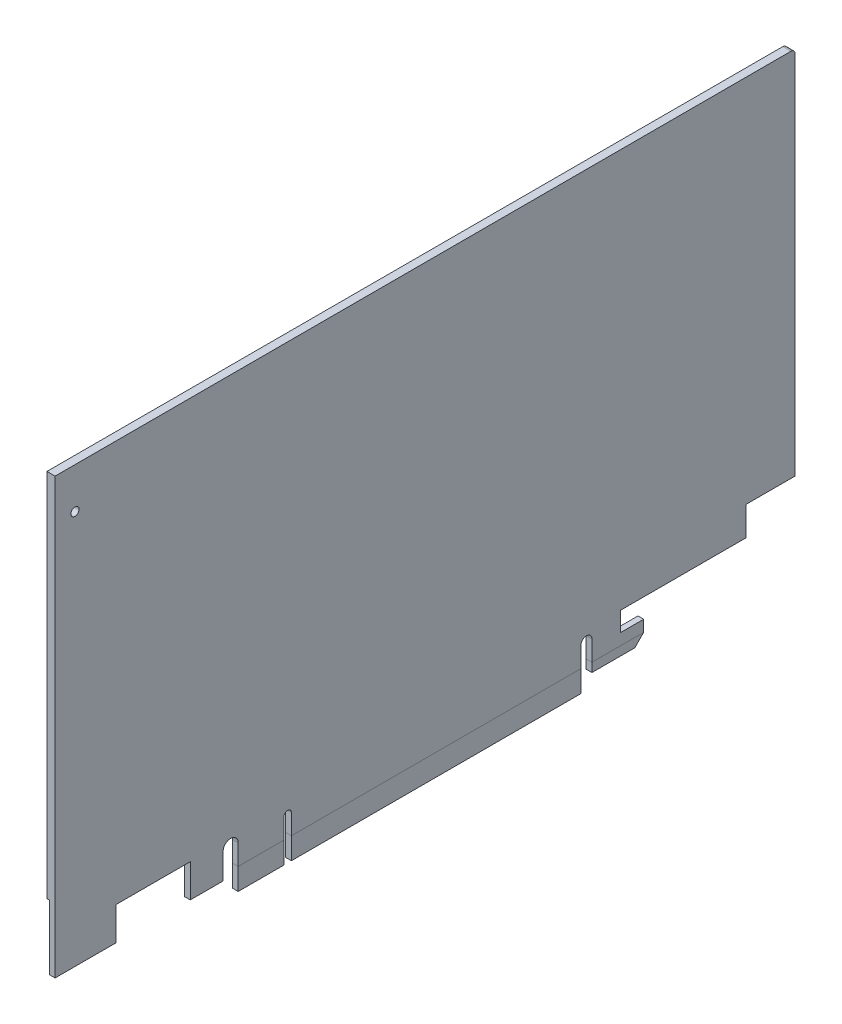
from build123d import *

# Parameters (mm, degrees)
EXTRUDE_1_DEPTH        = 1.4
SKETCH_3_W             = 71.21
SKETCH_3_H             = 5.33
EXTRUDE_2_DEPTH        = 1.4
SKETCH_3_W_2           = 12.74
SKETCH_3_H_2           = 2.2
EXTRUDE_2_2_DEPTH      = 1.4
SKETCH_3_W_3           = 11.28
EXTRUDE_2_3_DEPTH      = 1.4
CHAMFER_1_SIZE         = 2.2
SKETCH_5_W             = 182
SKETCH_5_H             = 91
EXTRUDE_4_DEPTH        = 2
SKETCH_6_R             = 1
CUT_EXTRUDE_2689_DEPTH = 2
FILLET_1_R             = 1


with BuildPart() as part:
    # 草图1 → 凸台-拉伸1 (new body)
    with BuildSketch(Plane(origin=(0, 0, 0), x_dir=(0, 0, -1), z_dir=(1, 0, 0))):
        with BuildLine():
            Line((-102.476101343, -30.47410665), (-102.476101343, -46.38410665))
            Line((-102.476101343, -46.38410665), (-87.476101343, -46.38410665))
            Line((-87.476101343, -46.38410665), (-87.476101343, -38.23410665))
            Line((-87.476101343, -38.23410665), (-69.226101343, -38.23410665))
            Line((-69.226101343, -38.23410665), (-69.226101343, -46.38410665))
            Line((-69.226101343, -46.38410665), (-61.146101343, -46.38410665))
            Line((-61.146101343, -46.38410665), (-61.146101343, -40.08410665))
            ThreePointArc((-61.146101343, -40.08410665), (-59.296101343, -38.23410665), (-57.446101343, -40.08410665))
            Line((-57.446101343, -40.08410665), (-57.446101343, -45.14410665))
            Line((-57.446101343, -45.14410665), (-46.166101343, -45.14410665))
            Line((-46.166101343, -45.14410665), (-46.166101343, -40.19410665))
            ThreePointArc((-46.166101343, -40.19410665), (-45.256101343, -39.28410665), (-44.346101343, -40.19410665))
            Line((-44.346101343, -40.19410665), (-44.346101343, -45.14410665))
            Line((-44.346101343, -45.14410665), (26.863898657, -45.14410665))
            Line((26.863898657, -45.14410665), (26.863898657, -40.19410665))
            ThreePointArc((26.863898657, -40.19410665), (28.213898657, -38.84410665), (29.563898657, -40.19410665))
            Line((29.563898657, -40.19410665), (29.563898657, -45.14410665))
            Line((29.563898657, -45.14410665), (42.303898657, -45.14410665))
            Line((42.303898657, -45.14410665), (42.303898657, -42.34410665))
            Line((42.303898657, -42.34410665), (36.593898657, -42.34410665))
            Line((36.593898657, -42.34410665), (36.593898657, -37.59410665))
            Line((36.593898657, -37.59410665), (67.523898657, -37.59410665))
            Line((67.523898657, -37.59410665), (67.523898657, -30.47410665))
            Line((67.523898657, -30.47410665), (-102.476101343, -30.47410665))
        make_face()
    extrude(amount=EXTRUDE_1_DEPTH)

    # 草图5 → 凸台-拉伸4 (add)
    with BuildSketch(Plane(origin=(1.4, 0, 0), x_dir=(0, 0, -1), z_dir=(1, 0, 0))):
        with Locations((-11.476101343, 15.02589335)):
            Rectangle(SKETCH_5_W, SKETCH_5_H)
    extrude(amount=-EXTRUDE_4_DEPTH)

    # 草图6 → Cut-Extrude 2689 (cut)
    with BuildSketch(Plane(origin=(1.4, 0, 0), x_dir=(0, 0, -1), z_dir=(1, 0, 0))):
        with Locations((-97.586101343, 50.51589335)):
            Circle(SKETCH_6_R)
    extrude(amount=-CUT_EXTRUDE_2689_DEPTH, mode=Mode.SUBTRACT)

    # 圆角1
    fillet_1_edges = [part.edges().sort_by_distance(p)[0] for p in [
        (0.4, 60.52589335, -79.523898657),
    ]]
    fillet(fillet_1_edges, radius=FILLET_1_R)


with BuildPart() as body_2:
    # 草图3 → 凸台-拉伸2 (new body)
    with BuildSketch(Plane(origin=(1.4, 0, 0), x_dir=(0, 0, -1), z_dir=(1, 0, 0))):
        with Locations((-8.741101343, -47.80910665)):
            Rectangle(SKETCH_3_W, SKETCH_3_H)
    extrude(amount=-EXTRUDE_2_DEPTH)


with BuildPart() as body_3:
    # 草图3 → Extrude 2 2 (new body)
    with BuildSketch(Plane(origin=(1.4, 0, 0), x_dir=(0, 0, -1), z_dir=(1, 0, 0))):
        with Locations((35.933898657, -46.24410665)):
            Rectangle(SKETCH_3_W_2, SKETCH_3_H_2)
    extrude(amount=-EXTRUDE_2_2_DEPTH)

    # 倒角1
    chamfer_1_edges = [body_3.edges().sort_by_distance(p)[0] for p in [
        (0.7, -47.34410665, -42.303898657),
    ]]
    chamfer(chamfer_1_edges, length=CHAMFER_1_SIZE - 0.0001)  # a hair under: the kernel refuses the full size


with BuildPart() as body_4:
    # 草图3 → Extrude 2 3 (new body)
    with BuildSketch(Plane(origin=(1.4, 0, 0), x_dir=(0, 0, -1), z_dir=(1, 0, 0))):
        with Locations((-51.806101343, -47.80910665)):
            Rectangle(SKETCH_3_W_3, SKETCH_3_H)
    extrude(amount=-EXTRUDE_2_3_DEPTH)


solid = Compound([part.part, body_2.part, body_3.part, body_4.part])
